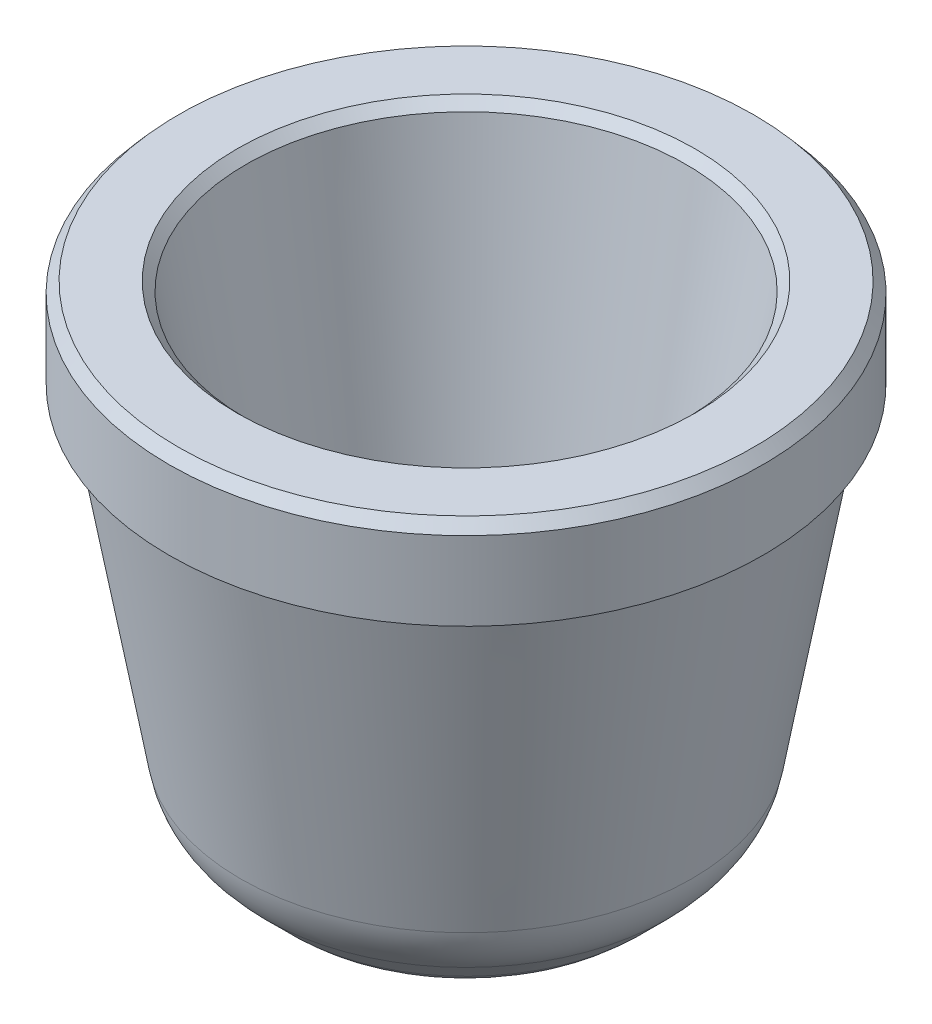
from build123d import *

# Parameters (mm, degrees)
FILLET1_R   = 1.524
SHELL1_T    = -1.27
SKETCH2_R   = 5.08
SKETCH2_R_2 = 3.790408203
RIM_DEPTH   = 1.524


with BuildPart() as part:
    # Sketch1 → Body (revolve)
    with BuildSketch(Plane.XY, mode=Mode.PRIVATE) as body_sk:
        Polygon((0, 0), (5.08, 0), (3.775004875, -7.400995125), (2.54, -8.636), (0, -8.636), align=None)
    revolve(body_sk.sketch.rotate(Axis((0, 0, 0), (0, -1, 0)), 90), axis=Axis((0, 0, 0), (0, -1, 0)))

    # Fillet1
    fillet1_edges = [part.edges().sort_by_distance(p)[0] for p in [
        (0, -8.636, -2.54),
        (0, -7.400995125, -3.775004875),
    ]]
    fillet(fillet1_edges, radius=FILLET1_R)

    # Shell1
    shell1_openings = [part.faces().sort_by_distance(p)[0] for p in [
        (0, 0, 0),
    ]]
    offset(amount=SHELL1_T, openings=shell1_openings, kind=Kind.INTERSECTION)

    # Sketch2 → Rim (add)
    with BuildSketch(Plane(origin=(0, 0, 0), x_dir=(-1, 0, 0), z_dir=(0, 1, 0))):
        with Locations(Location((0, 0, 0), (0, 0, 90))):
            Circle(SKETCH2_R)
        Circle(SKETCH2_R_2, mode=Mode.SUBTRACT)
    extrude(amount=-RIM_DEPTH)

    # Chamfer1: read off the stored shape, not the designer's step
    # Chamfer1 outline → Chamfer1 (revolve, cut)
    with BuildSketch(Plane.XY):
        Polygon((5.08, 0), (4.923434012, 0), (5.08, -0.181374797), align=None)
        Polygon((3.763220804, -0.154187398), (3.917408203, 0), (3.763220804, 0), align=None)
    revolve(axis=Axis((0, 0, 0), (0, 1, 0)), mode=Mode.SUBTRACT)


solid = part.part
